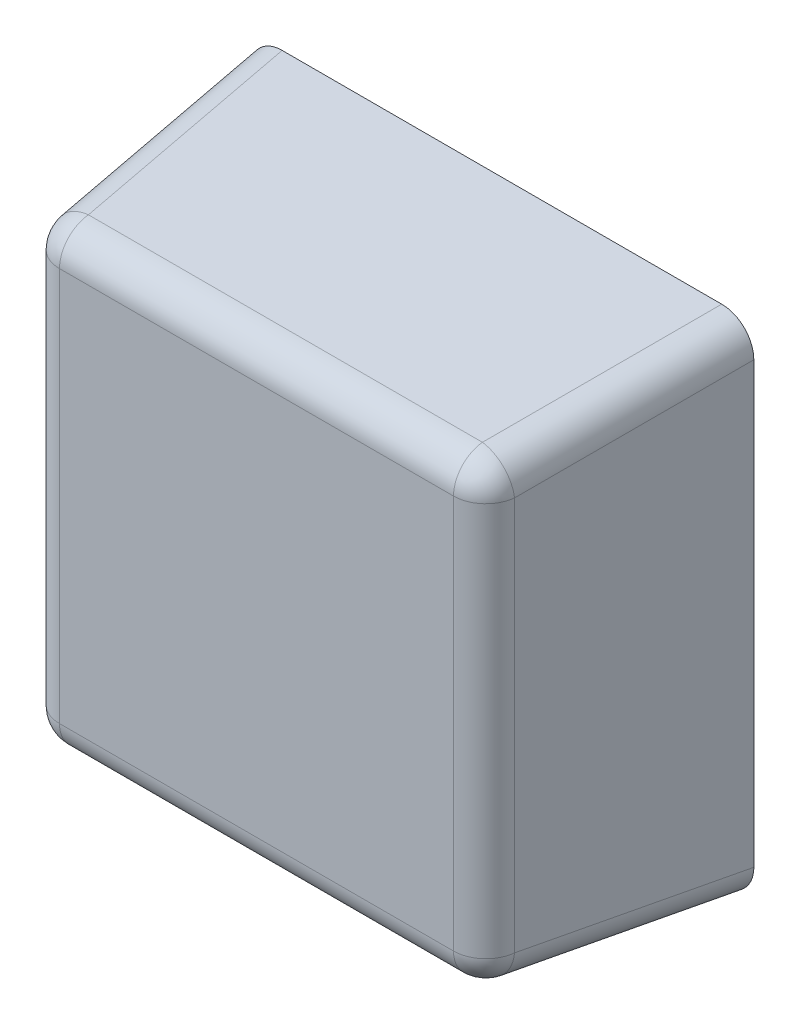
from build123d import *

# Parameters (mm, degrees)
SKETCH1_W           = 19.812
SKETCH1_H           = 19.812
BOSS_EXTRUDE1_DEPTH = 9.652
BOSS_EXTRUDE1_TAPER = 6
FILLET1_R           = 1.27


with BuildPart() as part:
    # Sketch1 → Boss-Extrude1 (new body)
    with BuildSketch(Plane.XY):
        with Locations((9.906, -9.906)):
            Rectangle(SKETCH1_W, SKETCH1_H)
    extrude(amount=BOSS_EXTRUDE1_DEPTH, taper=BOSS_EXTRUDE1_TAPER)

    # Fillet1
    fillet1_edges = [part.edges().sort_by_distance(p)[0] for p in [
        (9.906, -1.014466079, 9.652),
        (18.797533921, -9.906, 9.652),
        (9.906, -18.797533921, 9.652),
        (1.014466079, -9.906, 9.652),
        (19.304766961, -19.304766961, 4.826),
        (0.507233501, -19.304766499, 4.826004395),
        (0.507233039, -0.507233039, 4.826),
        (19.304766961, -0.507233039, 4.826),
    ]]
    fillet(fillet1_edges, radius=FILLET1_R)


solid = part.part
